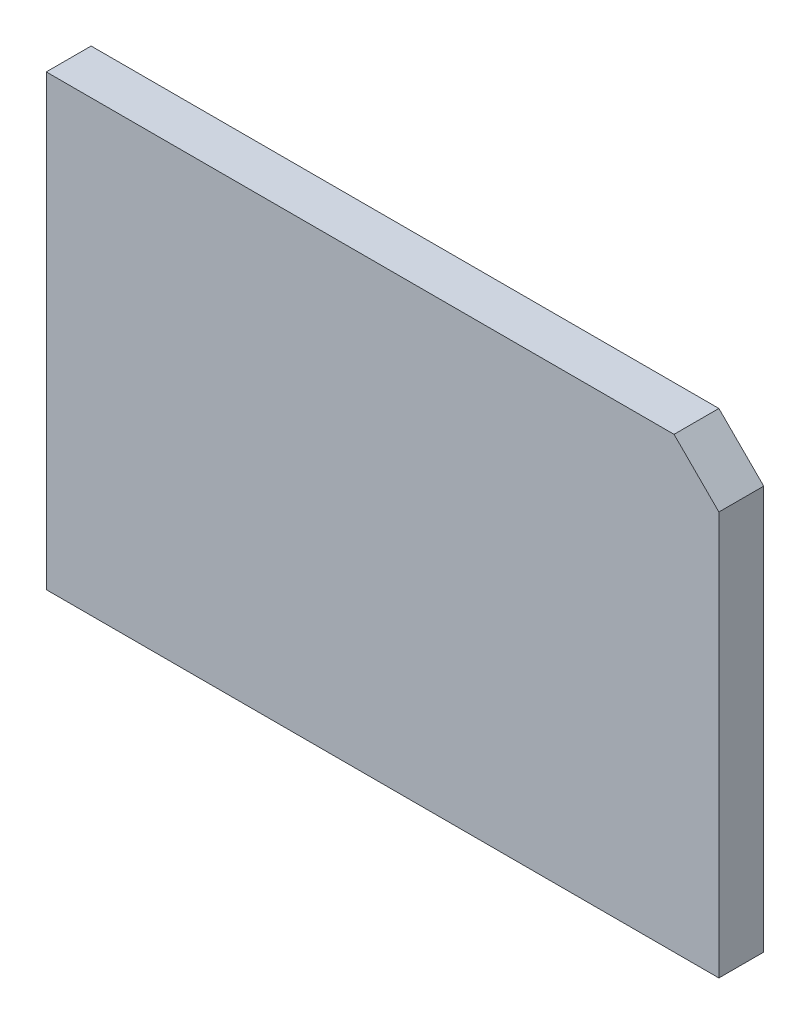
from build123d import *

# Parameters (mm, degrees)
SKETCH1_W           = 1500
SKETCH1_H           = 1000
BOSS_EXTRUDE1_DEPTH = 100
CUT_EXTRUDE1_DEPTH  = 200


with BuildPart() as part:
    # Sketch1 → Boss-Extrude1 (new body)
    with BuildSketch(Plane.XY):
        Rectangle(SKETCH1_W, SKETCH1_H)
    extrude(amount=-BOSS_EXTRUDE1_DEPTH)

    # Sketch2 → Cut-Extrude1 (cut)
    with BuildSketch(Plane.XY):
        Polygon((650, 500), (750, 400), (750, 500), align=None)
    extrude(amount=-CUT_EXTRUDE1_DEPTH, mode=Mode.SUBTRACT)


solid = part.part
